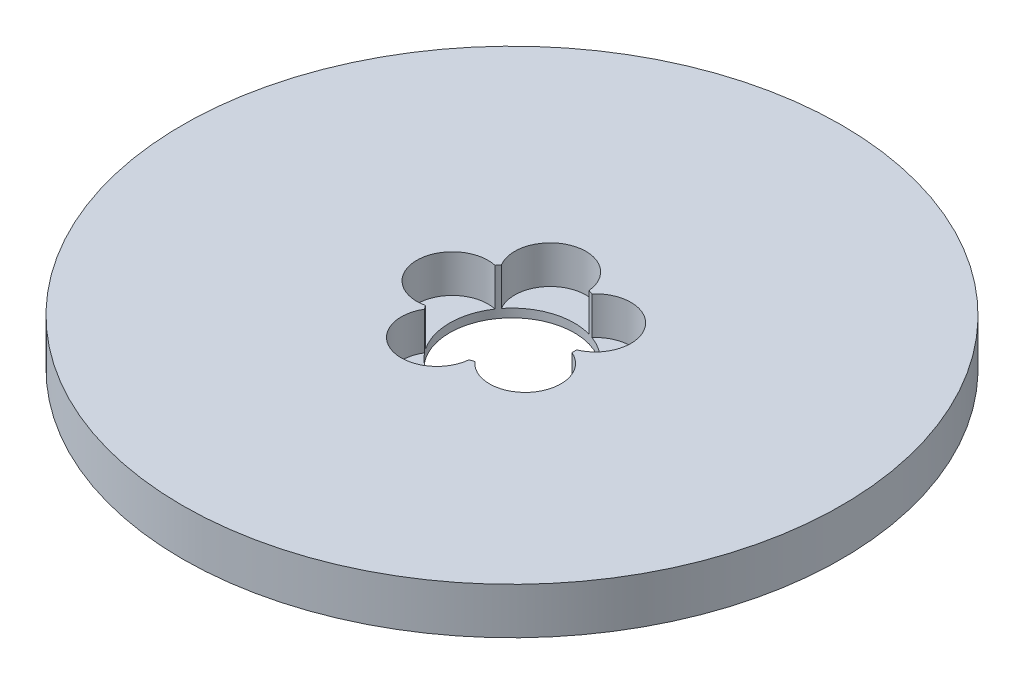
from build123d import *

# Parameters (mm, degrees)
SKETCH1_R           = 92.5
BOSS_EXTRUDE1_DEPTH = 13
SKETCH2_R           = 17.5
CUT_EXTRUDE1_DEPTH  = 132.459119121
SKETCH3_R           = 10
CUT_EXTRUDE2_DEPTH  = 10.618281544
CIRPATTERN1_COUNT   = 5


with BuildPart() as part:
    # Sketch1 → Boss-Extrude1 (new body)
    with BuildSketch(Plane(origin=(0, 0, 0), x_dir=(1, 0, 0), z_dir=(0, 1, 0))):
        Circle(SKETCH1_R)
    extrude(amount=BOSS_EXTRUDE1_DEPTH)

    # Sketch2 → Cut-Extrude1 (cut, through all)
    with BuildSketch(Plane(origin=(0, 0, 0), x_dir=(1, 0, 0), z_dir=(0, 1, 0))):
        Circle(SKETCH2_R)
    extrude(amount=CUT_EXTRUDE1_DEPTH, mode=Mode.SUBTRACT)

    # Sketch3 → Cut-Extrude2 (cut)
    with BuildSketch(Plane(origin=(0, 13, 0), x_dir=(1, 0, 0), z_dir=(0, 1, 0))):
        with Locations((-16.735268537, 0)):
            Circle(SKETCH3_R)
    cut_extrude2 = extrude(amount=-CUT_EXTRUDE2_DEPTH, mode=Mode.SUBTRACT)

    # CirPattern1: Cut-Extrude2 ×5 about axis
    cirpattern1_axis = Axis((0, 0, 0), (0, 1, 0))
    for i in range(1, CIRPATTERN1_COUNT):
        add(cut_extrude2.rotate(cirpattern1_axis, i * 360 / CIRPATTERN1_COUNT), mode=Mode.SUBTRACT)


solid = part.part
